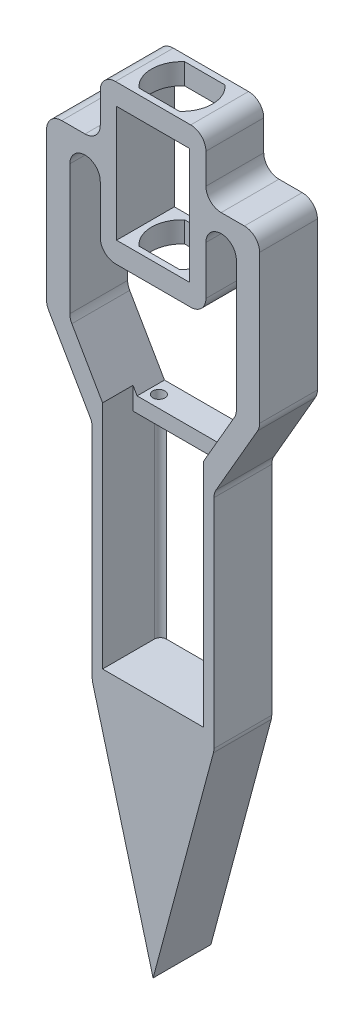
from build123d import *

# Parameters (mm, degrees)
BOSS_EXTRUDE1_DEPTH  = 6.9
BOSS_EXTRUDE2_START  = -6.9
BOSS_EXTRUDE2_DEPTH  = 51.9
CUT_EXTRUDE1_DEPTH   = 50.160278182
BOSS_EXTRUDE4_START  = -6.9
BOSS_EXTRUDE4_DEPTH  = 6.9
BOSS_EXTRUDE5_DEPTH  = 19
BOSS_EXTRUDE8_DEPTH  = 19
CUT_EXTRUDE2_DEPTH   = 38.1
SKETCH16_W           = 3.4
SKETCH16_H           = 19
BOSS_EXTRUDE10_DEPTH = 68.4
BOSS_EXTRUDE11_DEPTH = 68.4
SKETCH18_W           = 40
SKETCH18_H           = 19
BOSS_EXTRUDE12_DEPTH = 5
CUT_EXTRUDE3_START   = -7.338241
SKETCH20_W           = 33.2
SKETCH20_H           = 10
CUT_EXTRUDE3_DEPTH   = 7.338241
BOSS_EXTRUDE13_DEPTH = 19
FILLET1_R            = 5
SKETCH22_R           = 2
CUT_EXTRUDE4_DEPTH   = 49.030762114


with BuildPart() as part:
    # Sketch1 → Boss-Extrude1 (new body)
    with BuildSketch(Plane(origin=(0, 0, 0), x_dir=(1, 0, 0), z_dir=(0, 1, 0))):
        with BuildLine():
            ThreePointArc((7.36326441, 9.5), (12.000269064, 0), (7.36326441, -9.5))
            Line((7.36326441, -9.5), (0, -9.5))
            Line((0, -9.5), (-7.36326441, -9.5))
            ThreePointArc((-7.36326441, -9.5), (-12.000269064, 0), (-7.36326441, 9.5))
            Line((-7.36326441, 9.5), (0, 9.5))
            Line((0, 9.5), (7.36326441, 9.5))
        make_face()
        with BuildLine():
            Line((0, 7.5), (6.64, 7.5))
            ThreePointArc((6.64, 7.5), (10.000269064, 0), (6.64, -7.5))
            Line((6.64, -7.5), (0, -7.5))
            Line((0, -7.5), (-6.64, -7.5))
            ThreePointArc((-6.64, -7.5), (-10.000269064, 0), (-6.64, 7.5))
            Line((-6.64, 7.5), (0, 7.5))
        make_face(mode=Mode.SUBTRACT)
    extrude(amount=BOSS_EXTRUDE1_DEPTH)

    # Sketch2 → Boss-Extrude2 (add)
    with BuildSketch(Plane(origin=(0, 6.9, 0), x_dir=(1, 0, 0), z_dir=(0, 1, 0)).offset(BOSS_EXTRUDE2_START)):
        with BuildLine():
            Line((-7.36326441, 9.5), (-17.36326441, 9.5))
            Line((-17.36326441, 9.5), (-17.36326441, -9.5))
            Line((-17.36326441, -9.5), (-7.36326441, -9.5))
            ThreePointArc((-7.36326441, -9.5), (-12.000269064, 0), (-7.36326441, 9.5))
        make_face()
    boss_extrude2 = extrude(amount=BOSS_EXTRUDE2_DEPTH)

    # Sketch4 → Cut-Extrude1 (cut, through all)
    with BuildSketch(Plane(origin=(0, 6.9, 0), x_dir=(1, 0, 0), z_dir=(0, 1, 0))):
        with BuildLine():
            Line((-10.915369405, -4.996906494), (-8.86326441, -9.5))
            Line((-8.86326441, -9.5), (-7.36326441, -9.5))
            ThreePointArc((-7.36326441, -9.5), (-9.411139164, -7.462870557), (-10.915369405, -4.996906494))
        make_face()
        with BuildLine():
            Line((-10.915369405, 4.996906494), (-8.86326441, 9.5))
            Line((-8.86326441, 9.5), (-7.36326441, 9.5))
            ThreePointArc((-7.36326441, 9.5), (-9.411139164, 7.462870557), (-10.915369405, 4.996906494))
        make_face()
    cut_extrude1 = extrude(amount=CUT_EXTRUDE1_DEPTH, mode=Mode.SUBTRACT)

    # Mirror2: Boss-Extrude2, Cut-Extrude1 across plane
    add(boss_extrude2.mirror(Plane(origin=(0, 0, 0), x_dir=(0, 0, 1), z_dir=(1, 0, 0))))
    add(cut_extrude1.mirror(Plane(origin=(0, 0, 0), x_dir=(0, 0, 1), z_dir=(1, 0, 0))), mode=Mode.SUBTRACT)

    # Sketch6 → Boss-Extrude4 (add)
    with BuildSketch(Plane(origin=(0, 51.9, 0), x_dir=(1, 0, 0), z_dir=(0, 1, 0)).offset(BOSS_EXTRUDE4_START)):
        with BuildLine():
            Line((10.915369405, 4.996906494), (8.86326441, 9.5))
            Line((8.86326441, 9.5), (-8.86326441, 9.5))
            Line((-8.86326441, 9.5), (-10.915369405, 4.996906494))
            ThreePointArc((-10.915369405, 4.996906494), (-12.000269064, 0), (-10.915369405, -4.996906494))
            Line((-10.915369405, -4.996906494), (-8.86326441, -9.5))
            Line((-8.86326441, -9.5), (8.86326441, -9.5))
            Line((8.86326441, -9.5), (10.915369405, -4.996906494))
            ThreePointArc((10.915369405, -4.996906494), (12.000269064, 0), (10.915369405, 4.996906494))
        make_face()
        with BuildLine():
            Line((-6.64, 7.5), (6.64, 7.5))
            ThreePointArc((6.64, 7.5), (10.000269064, 0), (6.64, -7.5))
            Line((6.64, -7.5), (-6.64, -7.5))
            ThreePointArc((-6.64, -7.5), (-10.000269064, 0), (-6.64, 7.5))
        make_face(mode=Mode.SUBTRACT)
    extrude(amount=BOSS_EXTRUDE4_DEPTH)

    # Sketch7 → Boss-Extrude5 (add)
    with BuildSketch(Plane.XY.offset(9.5)):
        Polygon((-17.36326441, 31.95), (-35, 31.95), (-35, -23.05), (-27.36326441, -23.05), (-27.36326441, 25.95), (-17.36326441, 25.95), align=None)
    boss_extrude5 = extrude(amount=-BOSS_EXTRUDE5_DEPTH)

    # Mirror4: Boss-Extrude5 across plane
    add(boss_extrude5.mirror(Plane(origin=(0, 0, 0), x_dir=(0, 0, 1), z_dir=(1, 0, 0))))

    # Sketch11 → Boss-Extrude8 (add)
    with BuildSketch(Plane.XY.offset(9.5)):
        Polygon((-35, -23.05), (-20, -49.030762114), (20, -49.030762114), (35, -23.05), (27.36326441, -23.05), (15.250015756, -44.030762114), (-15.250015756, -44.030762114), (-27.36326441, -23.05), align=None)
    extrude(amount=-BOSS_EXTRUDE8_DEPTH)

    # Sketch15 → Cut-Extrude2 (cut)
    with BuildSketch(Plane(origin=(0, 6.9, 0), x_dir=(1, 0, 0), z_dir=(0, 1, 0))):
        Polygon((-12.000269064, 0), (-12.000269064, 9.5), (12.000269064, 9.5), (12.000269064, 0), (12.000269064, -9.5), (-12.000269064, -9.5), align=None)
    extrude(amount=CUT_EXTRUDE2_DEPTH, mode=Mode.SUBTRACT)

    # Sketch16 → Boss-Extrude10 (add)
    with BuildSketch(Plane.XZ.offset(49.030762114)):
        with Locations((-18.3, 0)):
            Rectangle(SKETCH16_W, SKETCH16_H)
        with Locations((18.3, 0)):
            Rectangle(SKETCH16_W, SKETCH16_H)
    extrude(amount=BOSS_EXTRUDE10_DEPTH)

    # Sketch17 → Boss-Extrude11 (add)
    with BuildSketch(Plane.XZ.offset(49.030762114)):
        with BuildLine():
            Line((-14.6, -9.5), (-16.6, -9.5))
            Line((-16.6, -9.5), (-16.6, -7.5))
            ThreePointArc((-16.6, -7.5), (-16.014213562, -8.914213562), (-14.6, -9.5))
        make_face()
        with BuildLine():
            Line((14.6, -9.5), (16.6, -9.5))
            Line((16.6, -9.5), (16.6, -7.5))
            ThreePointArc((16.6, -7.5), (16.014213562, -8.914213562), (14.6, -9.5))
        make_face()
    extrude(amount=BOSS_EXTRUDE11_DEPTH)

    # Sketch18 → Boss-Extrude12 (add)
    with BuildSketch(Plane.XZ.offset(117.430762114)):
        Rectangle(SKETCH18_W, SKETCH18_H)
    extrude(amount=BOSS_EXTRUDE12_DEPTH)

    # Sketch20 → Cut-Extrude3 (cut)
    with BuildSketch(Plane.XZ.offset(49.030762114).offset(CUT_EXTRUDE3_START)):
        with Locations((0, 4.5)):
            Rectangle(SKETCH20_W, SKETCH20_H)
    extrude(amount=CUT_EXTRUDE3_DEPTH, mode=Mode.SUBTRACT)

    # Sketch21 → Boss-Extrude13 (add)
    with BuildSketch(Plane.XY.offset(9.5)):
        Polygon((-20, -122.430762114), (0, -197.071778265), (20, -122.430762114), align=None)
    extrude(amount=-BOSS_EXTRUDE13_DEPTH)

    # Fillet1
    fillet1_edges = [part.edges().sort_by_distance(p)[0] for p in [
        (20, -122.430762114, 0),
        (20, -49.030762114, 0),
        (35, -23.05, 0),
        (35, 31.95, 0),
        (17.36326441, 31.95, 0),
        (-17.36326441, 31.95, 0),
        (-35, 31.95, 0),
        (-35, -23.05, 0),
        (-20, -49.030762114, 0),
        (-20, -122.430762114, 0),
        (-17.36326441, 0, 0),
        (17.36326441, 25.95, 0),
        (17.36326441, 0, 0),
        (17.36326441, 51.9, 0),
        (-17.36326441, 25.95, 0),
        (-17.36326441, 51.9, 0),
        (-27.36326441, -23.05, 0),
        (27.36326441, -23.05, 0),
        (27.36326441, 25.95, 0),
        (-27.36326441, 25.95, 0),
    ]]
    fillet(fillet1_edges, radius=FILLET1_R - 0.0001)  # a hair under: the kernel refuses the full size

    # Sketch22 → Cut-Extrude4 (cut)
    with BuildSketch(Plane.XZ.offset(49.030762114)):
        with Locations(Location((-12.1, -4.5, 0), (0, 0, 270))):
            Circle(SKETCH22_R)
    extrude(amount=-CUT_EXTRUDE4_DEPTH, mode=Mode.SUBTRACT)


solid = part.part
